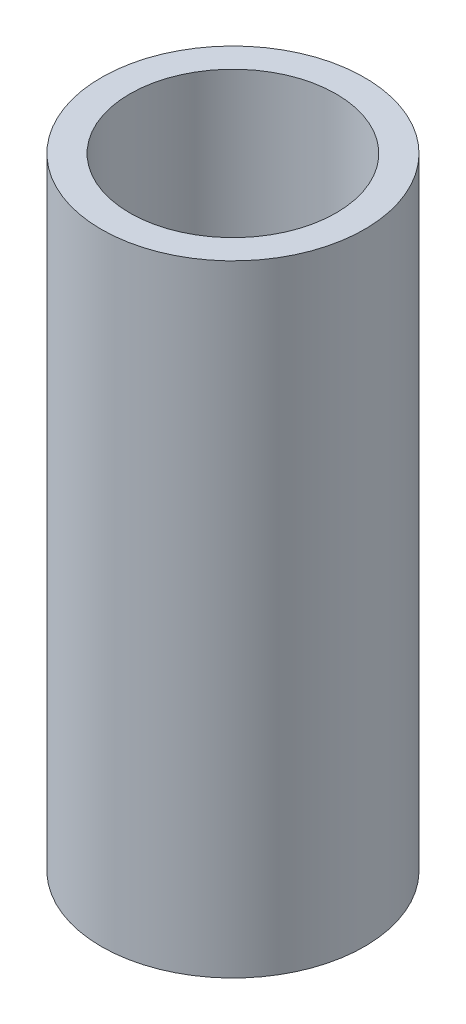
from build123d import *

# Parameters (mm, degrees)
SKETCH1_R           = 6.25
BOSS_EXTRUDE1_DEPTH = 29.5
SKETCH2_R           = 4.9
CUT_EXTRUDE1_DEPTH  = 31.795697751


with BuildPart() as part:
    # Sketch1 → Boss-Extrude1 (new body)
    with BuildSketch(Plane(origin=(0, 0, 0), x_dir=(1, 0, 0), z_dir=(0, 1, 0))):
        Circle(SKETCH1_R)
    extrude(amount=BOSS_EXTRUDE1_DEPTH)

    # Sketch2 → Cut-Extrude1 (cut, through all)
    with BuildSketch(Plane(origin=(0, 29.5, 0), x_dir=(1, 0, 0), z_dir=(0, 1, 0))):
        Circle(SKETCH2_R)
    extrude(amount=-CUT_EXTRUDE1_DEPTH, mode=Mode.SUBTRACT)


solid = part.part
